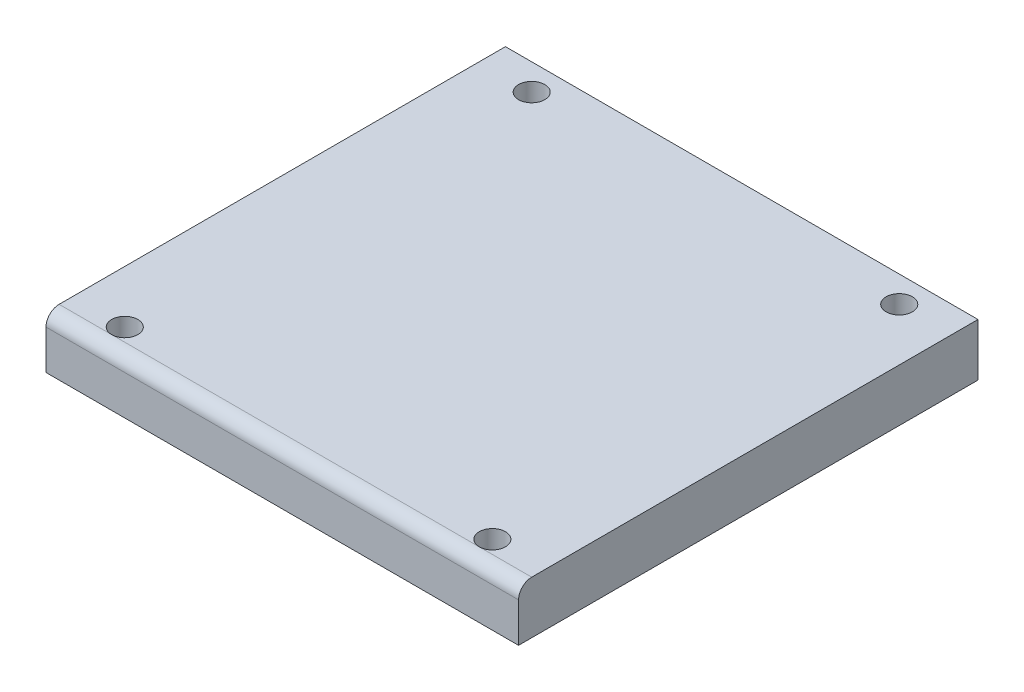
from build123d import *

# Parameters (mm, degrees)
SZKIC1_W                    = 180
SZKIC1_H                    = 175
SZKIC1_R                    = 5
SZKIC1_R_2                  = 2.75
DODANIE_WYCI_GNI_CIE1_DEPTH = 3
SZKIC1_4_W                  = 180
SZKIC1_4_H                  = 175
SZKIC1_4_R                  = 5
DODANIE_WYCI_GNI_CIE2_DEPTH = 20
ZAOKR_GLENIE1_R             = 5


with BuildPart() as part:
    # Szkic1 → Dodanie-wyciągnięcie1 (new body)
    # profile 1 of 5: a face of its own
    with BuildSketch(Plane(origin=(0, 0, 0), x_dir=(1, 0, 0), z_dir=(0, 1, 0))):
        Rectangle(SZKIC1_W, SZKIC1_H)
        with Locations((70, -77.5)):
            Circle(SZKIC1_R, mode=Mode.SUBTRACT)
        with Locations((-70, -77.5)):
            Circle(SZKIC1_R, mode=Mode.SUBTRACT)
        with Locations((70, 77.5)):
            Circle(SZKIC1_R, mode=Mode.SUBTRACT)
        with Locations((-70, 77.5)):
            Circle(SZKIC1_R, mode=Mode.SUBTRACT)
    # profile 2 of 5: a face of its own
    with BuildSketch(Plane(origin=(0, 0, 0), x_dir=(1, 0, 0), z_dir=(0, 1, 0))):
        with Locations((-70, -77.5)):
            Circle(SZKIC1_R)
        with Locations(Location((-70, -77.5, 0), (0, 0, 270))):
            Circle(SZKIC1_R_2, mode=Mode.SUBTRACT)
    # profile 3 of 5: a face of its own
    with BuildSketch(Plane(origin=(0, 0, 0), x_dir=(1, 0, 0), z_dir=(0, 1, 0))):
        with Locations((-70, 77.5)):
            Circle(SZKIC1_R)
        with Locations(Location((-70, 77.5, 0), (0, 0, 270))):
            Circle(SZKIC1_R_2, mode=Mode.SUBTRACT)
    # profile 4 of 5: a face of its own
    with BuildSketch(Plane(origin=(0, 0, 0), x_dir=(1, 0, 0), z_dir=(0, 1, 0))):
        with Locations((70, 77.5)):
            Circle(SZKIC1_R)
        with Locations(Location((70, 77.5, 0), (0, 0, 270))):
            Circle(SZKIC1_R_2, mode=Mode.SUBTRACT)
    # profile 5 of 5: a face of its own
    with BuildSketch(Plane(origin=(0, 0, 0), x_dir=(1, 0, 0), z_dir=(0, 1, 0))):
        with Locations((70, -77.5)):
            Circle(SZKIC1_R)
        with Locations(Location((70, -77.5, 0), (0, 0, 270))):
            Circle(SZKIC1_R_2, mode=Mode.SUBTRACT)
    extrude(amount=DODANIE_WYCI_GNI_CIE1_DEPTH)

    # Szkic1<4> → Dodanie-wyciągnięcie2 (add)
    with BuildSketch(Plane(origin=(0, 0, 0), x_dir=(1, 0, 0), z_dir=(0, 1, 0))):
        Rectangle(SZKIC1_4_W, SZKIC1_4_H)
        with Locations(Location((70, -77.5, 0), (0, 0, 270))):
            Circle(SZKIC1_4_R, mode=Mode.SUBTRACT)
        with Locations(Location((-70, -77.5, 0), (0, 0, 270))):
            Circle(SZKIC1_4_R, mode=Mode.SUBTRACT)
        with Locations(Location((70, 77.5, 0), (0, 0, 270))):
            Circle(SZKIC1_4_R, mode=Mode.SUBTRACT)
        with Locations(Location((-70, 77.5, 0), (0, 0, 270))):
            Circle(SZKIC1_4_R, mode=Mode.SUBTRACT)
    extrude(amount=DODANIE_WYCI_GNI_CIE2_DEPTH)

    # Zaokrąglenie1
    zaokr_glenie1_edges = [part.edges().sort_by_distance(p)[0] for p in [
        (0, 20, 87.5),
    ]]
    fillet(zaokr_glenie1_edges, radius=ZAOKR_GLENIE1_R - 0.0001)  # a hair under: the kernel refuses the full size


solid = part.part
